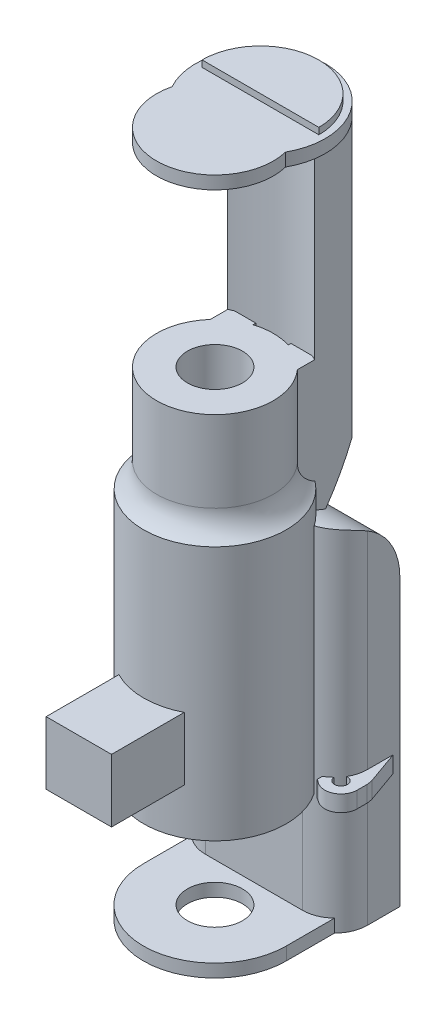
from build123d import *

# Parameters (mm, degrees)
BOSS_EXTRUDE1_DEPTH       = 2
BOSS_EXTRUDE2_DEPTH       = 1
BOSS_EXTRUDE3_DEPTH       = 33
BOSS_EXTRUDE4_DEPTH       = 7
BOSS_EXTRUDE4_DEPTH_BACK  = 7
CUT_EXTRUDE2_DEPTH        = 21
CUT_EXTRUDE3_DEPTH        = 21
CUT_EXTRUDE4_DEPTH        = 21
SKETCH46_R                = 4.25
CUT_EXTRUDE5_DEPTH        = 1
SKETCH47_R                = 9
BOSS_EXTRUDE5_DEPTH       = 17
SKETCH50_R                = 11
BOSS_EXTRUDE6_DEPTH       = 38.5
FILLET7_R                 = 4.5
SKETCH52_W                = 4
SKETCH52_H                = 17
BOSS_EXTRUDE7_DEPTH       = 4.5
BOSS_EXTRUDE8_DEPTH       = 3
BOSS_EXTRUDE8_DEPTH_BACK  = 7
SKETCH54_W                = 25
SKETCH54_H                = 54
FILLET11_R                = 10
FILLET16_R                = 5
BOSS_EXTRUDE9_DEPTH       = 2
CUT_EXTRUDE6_START        = -83
SKETCH56_R                = 4.25
CUT_EXTRUDE6_DEPTH        = 83
BOSS_EXTRUDE10_DEPTH      = 2.5
SKETCH59_W                = 15
SKETCH59_H                = 15
CUT_EXTRUDE7_DEPTH        = 2.5
BOSS_EXTRUDE11_DEPTH      = 10
BOSS_EXTRUDE11_DEPTH_BACK = 10
SKETCH61_W                = 10.079802636
SKETCH61_H                = 9.70238038


with BuildPart() as part:
    # Sketch2 → Boss-Extrude1 (new body)
    with BuildSketch(Plane(origin=(0, 0, 0), x_dir=(1, 0, 0), z_dir=(0, 1, 0))):
        with BuildLine():
            ThreePointArc((-8.74118042, -1.866920913), (0, -13.007777675), (8.74118042, -1.866920913))
            ThreePointArc((8.74118042, -1.866920913), (0, 13.007777675), (-8.74118042, -1.866920913))
        make_face()
    extrude(amount=BOSS_EXTRUDE1_DEPTH)

    # Sketch3 → Boss-Extrude2 (add)
    with BuildSketch(Plane(origin=(0, 2, 0), x_dir=(1, 0, 0), z_dir=(0, 1, 0))):
        with BuildLine():
            Line((-9.005745375, 3.0020323), (9.005745375, 3.0020323))
            ThreePointArc((9.005745375, 3.0020323), (0, 12.007777675), (-9.005745375, 3.0020323))
        make_face()
    extrude(amount=BOSS_EXTRUDE2_DEPTH)

    # Sketch6 → Boss-Extrude3 (add)
    with BuildSketch(Plane.XZ):
        with BuildLine():
            Line((-6.71029845, -10.424082907), (-6.71029845, -4.66194403))
            ThreePointArc((-6.71029845, -4.66194403), (0, -6.229684472), (6.71029845, -4.66194403))
            Line((6.71029845, -4.66194403), (6.71029845, -10.424082907))
            ThreePointArc((6.71029845, -10.424082907), (0, -13.046177942), (-6.71029845, -10.424082907))
        make_face()
    extrude(amount=BOSS_EXTRUDE3_DEPTH)

    # Sketch38 → Boss-Extrude4 (add, two sides: drawn at the far end of the back side and taken through both)
    with BuildSketch(Plane(origin=(0, 0, 0), x_dir=(0, 0, -1), z_dir=(1, 0, 0)).offset(-BOSS_EXTRUDE4_DEPTH_BACK)):
        with BuildLine():
            Line((4.66194403, -33), (4.66194403, -53))
            ThreePointArc((4.66194403, -53), (10.280825791, -43.598116493), (13.046177942, -33))
            Line((13.046177942, -33), (4.66194403, -33))
        make_face()
    extrude(amount=BOSS_EXTRUDE4_DEPTH + BOSS_EXTRUDE4_DEPTH_BACK)

    # Sketch43 → Cut-Extrude2 (cut)
    with BuildSketch(Plane(origin=(0, -33, 0), x_dir=(1, 0, 0), z_dir=(0, 1, 0))):
        with BuildLine():
            Line((-6.71029845, 4.66194403), (6.71029845, 4.66194403))
            ThreePointArc((6.71029845, 4.66194403), (0, 6.229684472), (-6.71029845, 4.66194403))
        make_face()
    extrude(amount=-CUT_EXTRUDE2_DEPTH, mode=Mode.SUBTRACT)

    # Sketch44 → Cut-Extrude3 (cut)
    with BuildSketch(Plane(origin=(0, -33, 0), x_dir=(1, 0, 0), z_dir=(0, 1, 0))):
        with BuildLine():
            Line((0, 13.046177942), (7, 13.046177942))
            Line((7, 13.046177942), (7, 4.66194403))
            Line((7, 4.66194403), (6.71029845, 4.66194403))
            Line((6.71029845, 4.66194403), (6.71029845, 10.424082907))
            ThreePointArc((6.71029845, 10.424082907), (3.602203758, 12.367376636), (0, 13.046177942))
        make_face()
    extrude(amount=-CUT_EXTRUDE3_DEPTH, mode=Mode.SUBTRACT)

    # Sketch45 → Cut-Extrude4 (cut)
    with BuildSketch(Plane(origin=(0, -33, 0), x_dir=(1, 0, 0), z_dir=(0, 1, 0))):
        with BuildLine():
            Line((-6.71029845, 4.66194403), (-7, 4.66194403))
            Line((-7, 4.66194403), (-7, 13.046177942))
            Line((-7, 13.046177942), (0, 13.046177942))
            ThreePointArc((0, 13.046177942), (-3.602203758, 12.367376636), (-6.71029845, 10.424082907))
            Line((-6.71029845, 10.424082907), (-6.71029845, 4.66194403))
        make_face()
    extrude(amount=-CUT_EXTRUDE4_DEPTH, mode=Mode.SUBTRACT)

    # Sketch46 → Cut-Extrude5 (cut)
    with BuildSketch(Plane.XZ):
        with Locations(Location((0, 4.008159027, 0), (0, 0, 270))):
            Circle(SKETCH46_R)
    extrude(amount=-CUT_EXTRUDE5_DEPTH, mode=Mode.SUBTRACT)



with BuildPart() as body_2:
    # Sketch47 → Boss-Extrude5 (new body)
    with BuildSketch(Plane(origin=(0, -30, 0), x_dir=(1, 0, 0), z_dir=(0, 1, 0))):
        with Locations(Location((0, -4.008159027, 0), (0, 0, 270))):
            Circle(SKETCH47_R)
    extrude(amount=-BOSS_EXTRUDE5_DEPTH)


with BuildPart() as part_1:
    add(part.part)

    add(body_2.part)  # Boss-Extrude6 merges body 2
    # Sketch50 → Boss-Extrude6 (add)
    with BuildSketch(Plane(origin=(0, -47, 0), x_dir=(1, 0, 0), z_dir=(0, 1, 0))):
        with Locations(Location((0, -4.008159027, 0), (0, 0, 270))):
            Circle(SKETCH50_R)
    extrude(amount=-BOSS_EXTRUDE6_DEPTH)

    # Fillet7
    # the kernel refuses this fillet: 4.5 mm, written as the material it adds along each edge
    with BuildSketch(Plane(origin=(0, -47, 4.008159027), x_dir=(0, 0, 1), z_dir=(-1, 0, 0))) as fillet7_piece_1_section:
        with BuildLine():
            CenterArc((9 + FILLET7_R, FILLET7_R), FILLET7_R, 180, 90)
            Line((9, FILLET7_R), (9, 0))
            Line((9, 0), (9 + FILLET7_R, 0))
        make_face()
    fillet7_piece_1 = revolve(axis=Axis((0, -47, 4.008159027), (0, 1, 0)), mode=Mode.PRIVATE)
    fillet7_piece_1 = fillet7_piece_1 & Plane(origin=(0, -44.651534587, 4.008159027), x_dir=(0, 0, 1), z_dir=(0, 1, 0)) * Cylinder(11, 54, mode=Mode.PRIVATE)
    add(fillet7_piece_1)

    # Sketch52 → Boss-Extrude7 (add)
    with BuildSketch(Plane.XY.offset(-5)):
        with Locations((-4.71029845, -38.5)):
            Rectangle(SKETCH52_W, SKETCH52_H)
        with Locations((4.71029845, -38.5)):
            Rectangle(SKETCH52_W, SKETCH52_H)
    extrude(amount=BOSS_EXTRUDE7_DEPTH)

    # Sketch54 → Boss-Extrude8 (add, two sides: drawn at the far end of the back side and taken through both)
    with BuildSketch(Plane.XY.offset(-5).offset(-BOSS_EXTRUDE8_DEPTH_BACK)):
        with Locations((0, -76.799982276)):
            Rectangle(SKETCH54_W, SKETCH54_H)
    extrude(amount=BOSS_EXTRUDE8_DEPTH + BOSS_EXTRUDE8_DEPTH_BACK)

    # Fillet11
    # the kernel refuses this fillet: 10 mm, written as the material it takes off along each edge
    with BuildSketch(Plane(origin=(37.5, -49.799982276, -12), x_dir=(0, 0, 1), z_dir=(-1, 0, 0))) as fillet11_piece_1_section:
        with BuildLine():
            CenterArc((FILLET11_R, -FILLET11_R), FILLET11_R, 90, 90)
            Line((0, -FILLET11_R), (0, 0))
            Line((0, 0), (FILLET11_R, 0))
        make_face()
    fillet11_piece_1 = extrude(amount=75, mode=Mode.PRIVATE)
    fillet11_piece_1 = split(fillet11_piece_1, bisect_by=Plane(origin=(6.71029845, -50.105722429, -5.552983342), z_dir=(1, 0, 0)), keep=Keep.TOP, mode=Mode.PRIVATE)
    fillet11_piece_1 = fillet11_piece_1 - Plane(origin=(0, -50.105722429, 4.008159027), x_dir=(0, 0, 1), z_dir=(0, 1, 0)) * Cylinder(11, 190, mode=Mode.PRIVATE)
    add(fillet11_piece_1, mode=Mode.SUBTRACT)
    with BuildSketch(Plane(origin=(37.5, -49.799982276, -12), x_dir=(0, 0, 1), z_dir=(-1, 0, 0))) as fillet11_piece_2_section:
        with BuildLine():
            CenterArc((FILLET11_R, -FILLET11_R), FILLET11_R, 90, 90)
            Line((0, -FILLET11_R), (0, 0))
            Line((0, 0), (FILLET11_R, 0))
        make_face()
    fillet11_piece_2 = extrude(amount=75, mode=Mode.PRIVATE)
    fillet11_piece_2 = fillet11_piece_2 - Plane(origin=(0, -28.608070144, 25.47687493), x_dir=(0, -0.6291022196918398, -0.7773225824448948), z_dir=(-1, 0, 0)) * Cylinder(38.772601801, 190, mode=Mode.PRIVATE)
    add(fillet11_piece_2, mode=Mode.SUBTRACT)
    with BuildSketch(Plane(origin=(37.5, -49.799982276, -12), x_dir=(0, 0, 1), z_dir=(-1, 0, 0))) as fillet11_piece_3_section:
        with BuildLine():
            CenterArc((FILLET11_R, -FILLET11_R), FILLET11_R, 90, 90)
            Line((0, -FILLET11_R), (0, 0))
            Line((0, 0), (FILLET11_R, 0))
        make_face()
    fillet11_piece_3 = extrude(amount=75, mode=Mode.PRIVATE)
    fillet11_piece_3 = split(fillet11_piece_3, bisect_by=Plane(origin=(-6.71029845, -50.105722431, -5.552983374), z_dir=(-1, 0, 0)), keep=Keep.TOP, mode=Mode.PRIVATE)
    fillet11_piece_3 = fillet11_piece_3 - Plane(origin=(0, -50.105722431, 4.008159027), x_dir=(0, 0, 1), z_dir=(0, 1, 0)) * Cylinder(11, 190, mode=Mode.PRIVATE)
    add(fillet11_piece_3, mode=Mode.SUBTRACT)

    # Fillet16
    # the kernel refuses this fillet: 5 mm, written as the material it takes off along each edge
    with BuildSketch(Plane(origin=(12.5, -116.299982276, -2), x_dir=(0, 0, -1), z_dir=(0, 1, 0))) as fillet16_piece_1_section:
        with BuildLine():
            CenterArc((FILLET16_R, FILLET16_R), FILLET16_R, 180, 90)
            Line((0, FILLET16_R), (0, 0))
            Line((0, 0), (FILLET16_R, 0))
        make_face()
    fillet16_piece_1 = extrude(amount=79, mode=Mode.PRIVATE)
    fillet16_piece_1 = split(fillet16_piece_1, bisect_by=Plane(origin=(11.51825919, -85.5, -3.19162615), z_dir=(0, -1, 0)), keep=Keep.TOP, mode=Mode.PRIVATE)
    fillet16_piece_1 = fillet16_piece_1 - Plane(origin=(0, -100.899991138, 4.008159027), x_dir=(0, 0, 1), z_dir=(0, 1, 0)) * Cylinder(11, 178, mode=Mode.PRIVATE)
    add(fillet16_piece_1, mode=Mode.SUBTRACT)
    with BuildSketch(Plane(origin=(12.5, -116.299982276, -2), x_dir=(0, 0, -1), z_dir=(0, 1, 0))) as fillet16_piece_2_section:
        with BuildLine():
            CenterArc((FILLET16_R, FILLET16_R), FILLET16_R, 180, 90)
            Line((0, FILLET16_R), (0, 0))
            Line((0, 0), (FILLET16_R, 0))
        make_face()
    fillet16_piece_2 = extrude(amount=79, mode=Mode.PRIVATE)
    fillet16_piece_2 = split(fillet16_piece_2, bisect_by=Plane(origin=(8.533879218, -85.5, -2.00668073), z_dir=(0, -1, 0)), keep=Keep.TOP, mode=Mode.PRIVATE)
    fillet16_piece_2 = fillet16_piece_2 & Plane(origin=(0, -100.899991138, 4.008159027), x_dir=(0, 0, 1), z_dir=(0, 1, 0)) * Cylinder(11, 178, mode=Mode.PRIVATE)
    add(fillet16_piece_2, mode=Mode.SUBTRACT)
    with BuildSketch(Plane(origin=(12.5, -116.299982276, -2), x_dir=(0, 0, -1), z_dir=(0, 1, 0))) as fillet16_piece_3_section:
        with BuildLine():
            CenterArc((FILLET16_R, FILLET16_R), FILLET16_R, 180, 90)
            Line((0, FILLET16_R), (0, 0))
            Line((0, 0), (FILLET16_R, 0))
        make_face()
    fillet16_piece_3 = extrude(amount=79, mode=Mode.PRIVATE)
    fillet16_piece_3 = split(fillet16_piece_3, bisect_by=Plane(origin=(11.51825919, -85.5, -3.19162615), z_dir=(0, 1, 0)), keep=Keep.TOP, mode=Mode.PRIVATE)
    fillet16_piece_3 = fillet16_piece_3 - Plane(origin=(0, -61.399991138, 4.008159027), x_dir=(0, 0, 1), z_dir=(0, 1, 0)) * Cylinder(11, 178, mode=Mode.PRIVATE)
    add(fillet16_piece_3, mode=Mode.SUBTRACT)
    with BuildSketch(Plane(origin=(-12.5, -37.299982276, -2), x_dir=(0, 0, -1), z_dir=(0, -1, 0))) as fillet16_piece_4_section:
        with BuildLine():
            CenterArc((FILLET16_R, FILLET16_R), FILLET16_R, 180, 90)
            Line((0, FILLET16_R), (0, 0))
            Line((0, 0), (FILLET16_R, 0))
        make_face()
    fillet16_piece_4 = extrude(amount=79, mode=Mode.PRIVATE)
    fillet16_piece_4 = fillet16_piece_4 - Plane(origin=(0, -61.399991138, 4.008159027), x_dir=(0, 0, 1), z_dir=(0, 1, 0)) * Cylinder(11, 178, mode=Mode.PRIVATE)
    fillet16_piece_4 = split(fillet16_piece_4, bisect_by=Plane(origin=(-11.51825919, -85.5, -3.19162615), z_dir=(0, 1, 0)), keep=Keep.TOP, mode=Mode.PRIVATE)
    add(fillet16_piece_4, mode=Mode.SUBTRACT)
    with BuildSketch(Plane(origin=(-12.5, -37.299982276, -2), x_dir=(0, 0, -1), z_dir=(0, -1, 0))) as fillet16_piece_5_section:
        with BuildLine():
            CenterArc((FILLET16_R, FILLET16_R), FILLET16_R, 180, 90)
            Line((0, FILLET16_R), (0, 0))
            Line((0, 0), (FILLET16_R, 0))
        make_face()
    fillet16_piece_5 = extrude(amount=79, mode=Mode.PRIVATE)
    fillet16_piece_5 = fillet16_piece_5 - Plane(origin=(0, -100.899991138, 4.008159027), x_dir=(0, 0, 1), z_dir=(0, 1, 0)) * Cylinder(11, 178, mode=Mode.PRIVATE)
    fillet16_piece_5 = split(fillet16_piece_5, bisect_by=Plane(origin=(-11.51825919, -85.5, -3.19162615), z_dir=(0, -1, 0)), keep=Keep.TOP, mode=Mode.PRIVATE)
    add(fillet16_piece_5, mode=Mode.SUBTRACT)
    with BuildSketch(Plane(origin=(-12.5, -37.299982276, -2), x_dir=(0, 0, -1), z_dir=(0, -1, 0))) as fillet16_piece_6_section:
        with BuildLine():
            CenterArc((FILLET16_R, FILLET16_R), FILLET16_R, 180, 90)
            Line((0, FILLET16_R), (0, 0))
            Line((0, 0), (FILLET16_R, 0))
        make_face()
    fillet16_piece_6 = extrude(amount=79, mode=Mode.PRIVATE)
    fillet16_piece_6 = fillet16_piece_6 & Plane(origin=(0, -100.899991138, 4.008159027), x_dir=(0, 0, 1), z_dir=(0, 1, 0)) * Cylinder(11, 178, mode=Mode.PRIVATE)
    fillet16_piece_6 = split(fillet16_piece_6, bisect_by=Plane(origin=(-8.533879218, -85.5, -2.00668073), z_dir=(0, -1, 0)), keep=Keep.TOP, mode=Mode.PRIVATE)
    add(fillet16_piece_6, mode=Mode.SUBTRACT)

    # Sketch55 → Boss-Extrude9 (add)
    with BuildSketch(Plane.XZ.offset(103.799982276)):
        with BuildLine():
            Line((-11, -5), (11, -5))
            Line((11, -5), (11, 4.008159027))
            ThreePointArc((11, 4.008159027), (0, 15.033520303), (-11, 4.008159027))
            Line((-11, 4.008159027), (-11, -5))
        make_face()
    extrude(amount=-BOSS_EXTRUDE9_DEPTH)

    # Sketch56 → Cut-Extrude6 (cut)
    with BuildSketch(Plane(origin=(0, -30, 0), x_dir=(1, 0, 0), z_dir=(0, 1, 0)).offset(CUT_EXTRUDE6_START)):
        with Locations(Location((0, -4.008159027, 0), (0, 0, 90))):
            Circle(SKETCH56_R)
    extrude(amount=CUT_EXTRUDE6_DEPTH, mode=Mode.SUBTRACT)

    # Sketch58 → Boss-Extrude10 (add)
    with BuildSketch(Plane(origin=(0, -85.5, 0), x_dir=(1, 0, 0), z_dir=(0, 1, 0))):
        with BuildLine():
            Line((-12.503756293, 10.7055016), (-12.503756293, 10.967623814))
            Line((-12.503756293, 10.967623814), (-14.284395942, 5.954796895))
            ThreePointArc((-14.284395942, 5.954796895), (-14.399896686, 5.457707003), (-14.457430322, 4.950628446))
            Line((-14.457430322, 4.950628446), (-14.457430322, 3.467540502))
            ThreePointArc((-14.457430322, 3.467540502), (-13.045141258, 1.216634056), (-10.403991329, 1.508981939))
            ThreePointArc((-10.403991329, 1.508981939), (-10.176629296, 1.672677814), (-9.935026042, 1.814514698))
            Line((-9.935026042, 1.814514698), (-9.935026042, 2.633004674))
            Line((-9.935026042, 2.633004674), (-10.95990675, 3.398756648))
            ThreePointArc((-10.95990675, 3.398756648), (-12.741140623, 2.846277711), (-11.796984516, 4.454567589))
            Line((-11.796984516, 4.454567589), (-11.885717448, 4.626710904))
            Line((-11.885717448, 4.626710904), (-12.141623772, 5.12317329))
            Line((-12.141623772, 5.12317329), (-12.22909809, 5.3725854))
            Line((-12.22909809, 5.3725854), (-12.297457465, 5.567027196))
            Line((-12.297457465, 5.567027196), (-12.408358344, 6.092489346))
            Line((-12.408358344, 6.092489346), (-12.439303168, 6.239029034))
            Line((-12.439303168, 6.239029034), (-12.503756293, 6.967623814))
            Line((-12.503756293, 6.967623814), (-12.503756293, 8.899304494))
            Line((-12.503756293, 8.899304494), (-12.503756293, 9.616252049))
            Line((-12.503756293, 9.616252049), (-12.503756293, 10.7055016))
        make_face()
        with BuildLine():
            Line((14.284395942, 5.954796895), (12.503756293, 10.967623814))
            Line((12.503756293, 10.967623814), (12.503756293, 10.7055016))
            Line((12.503756293, 10.7055016), (12.503756293, 9.616252049))
            Line((12.503756293, 9.616252049), (12.503756293, 8.899304494))
            Line((12.503756293, 8.899304494), (12.503756293, 6.967623814))
            Line((12.503756293, 6.967623814), (12.439303168, 6.239029034))
            Line((12.439303168, 6.239029034), (12.408358344, 6.092489346))
            Line((12.408358344, 6.092489346), (12.297457465, 5.567027196))
            Line((12.297457465, 5.567027196), (12.22909809, 5.3725854))
            Line((12.22909809, 5.3725854), (12.141623772, 5.12317329))
            Line((12.141623772, 5.12317329), (11.885717448, 4.626710904))
            Line((11.885717448, 4.626710904), (11.796984516, 4.454567589))
            ThreePointArc((11.796984516, 4.454567589), (12.60539873, 4.229299591), (12.957538336, 3.467540502))
            ThreePointArc((12.957538336, 3.467540502), (11.991950644, 2.468132781), (10.95990675, 3.398756648))
            Line((10.95990675, 3.398756648), (9.935026042, 2.633004674))
            Line((9.935026042, 2.633004674), (9.935026042, 1.814514698))
            ThreePointArc((9.935026042, 1.814514698), (10.176629296, 1.672677814), (10.403991329, 1.508981939))
            ThreePointArc((10.403991329, 1.508981939), (13.045141258, 1.216634056), (14.457430322, 3.467540502))
            Line((14.457430322, 3.467540502), (14.457430322, 4.950628446))
            ThreePointArc((14.457430322, 4.950628446), (14.399896686, 5.457707003), (14.284395942, 5.954796895))
        make_face()
    extrude(amount=BOSS_EXTRUDE10_DEPTH)

    # Sketch59 → Cut-Extrude7 (cut)
    with BuildSketch(Plane(origin=(0, 0, -12), x_dir=(-1, 0, 0), z_dir=(0, 0, -1))):
        with Locations((0, -72.428324933)):
            Rectangle(SKETCH59_W, SKETCH59_H)
    extrude(amount=-CUT_EXTRUDE7_DEPTH, mode=Mode.SUBTRACT)

    # Sketch61 → Boss-Extrude11 (add, two sides: drawn at the far end of the back side and taken through both)
    with BuildSketch(Plane.XY.offset(15).offset(-BOSS_EXTRUDE11_DEPTH_BACK)):
        with Locations((0.002925822, -73.553513647)):
            Rectangle(SKETCH61_W, SKETCH61_H)
    extrude(amount=BOSS_EXTRUDE11_DEPTH + BOSS_EXTRUDE11_DEPTH_BACK)


solid = part_1.part
